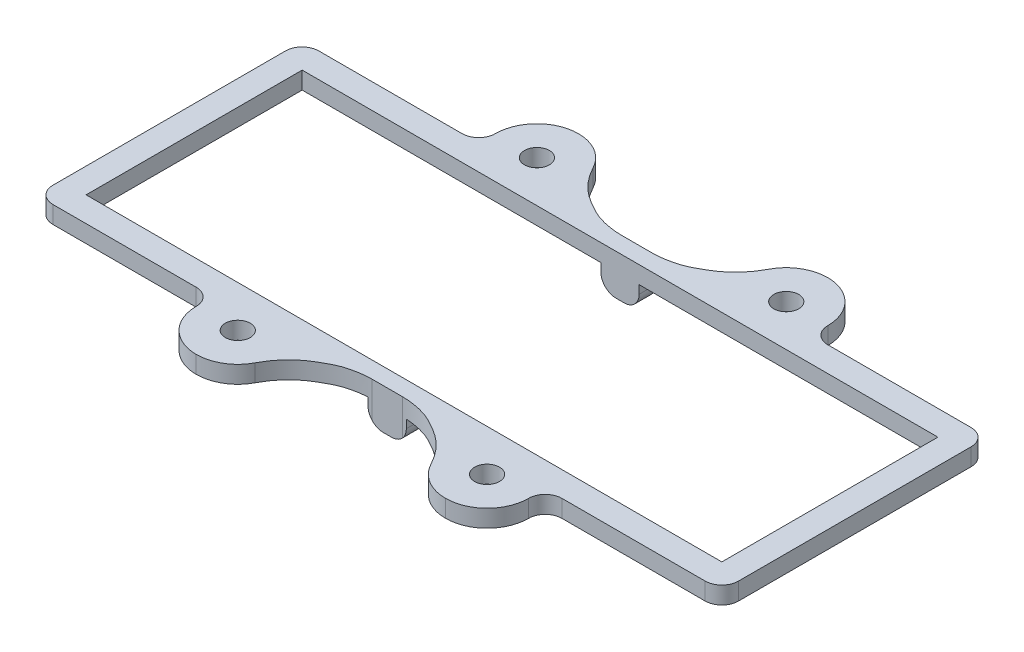
from build123d import *

# Parameters (mm, degrees)
SKETCH1_W           = 40
SKETCH1_H           = 7
SKETCH1_R           = 1.5
SKETCH1_W_2         = 82.5
SKETCH1_H_2         = 32
SKETCH1_W_3         = 76.5
SKETCH1_H_3         = 26
BOSS_EXTRUDE1_DEPTH = 2.085
SKETCH2_W           = 5
SKETCH2_H           = 10
BOSS_EXTRUDE2_DEPTH = 3
FILLET1_R           = 2
FILLET2_R           = 2
CUT_EXTRUDE1_DEPTH  = 65.136818612
SKETCH4_W           = 30
SKETCH4_H           = 6.817038716
CUT_EXTRUDE2_DEPTH  = 53.089568977
FILLET3_R           = 5
FILLET4_R           = 2


with BuildPart() as part:
    # Sketch1 → Boss-Extrude1 (new body)
    # profile 1 of 3: a face of its own
    with BuildSketch(Plane(origin=(0, 0, 0), x_dir=(1, 0, 0), z_dir=(0, 1, 0))):
        with Locations((-3.342953498, -16.024946279)):
            Rectangle(SKETCH1_W, SKETCH1_H)
        with Locations(Location((-18.342953498, -14.524946279, 0), (0, 0, 270))):
            Circle(SKETCH1_R, mode=Mode.SUBTRACT)
        with Locations(Location((11.657046502, -14.524946279, 0), (0, 0, 270))):
            Circle(SKETCH1_R, mode=Mode.SUBTRACT)
    # profile 2 of 3: a face of its own
    with BuildSketch(Plane(origin=(0, 0, 0), x_dir=(1, 0, 0), z_dir=(0, 1, 0))):
        with Locations((-3.342953498, 3.475053721)):
            Rectangle(SKETCH1_W_2, SKETCH1_H_2)
        with Locations((-3.342953498, 3.475053721)):
            Rectangle(SKETCH1_W_3, SKETCH1_H_3, mode=Mode.SUBTRACT)
    # profile 3 of 3: a face of its own
    with BuildSketch(Plane(origin=(0, 0, 0), x_dir=(1, 0, 0), z_dir=(0, 1, 0))):
        with Locations((-3.342953498, 22.975053721)):
            Rectangle(SKETCH1_W, SKETCH1_H)
        with Locations(Location((-18.342953498, 21.475053721, 0), (0, 0, 270))):
            Circle(SKETCH1_R, mode=Mode.SUBTRACT)
        with Locations(Location((11.657046502, 21.475053721, 0), (0, 0, 270))):
            Circle(SKETCH1_R, mode=Mode.SUBTRACT)
    extrude(amount=BOSS_EXTRUDE1_DEPTH)

    # Sketch2 → Boss-Extrude2 (add)
    with BuildSketch(Plane.XZ):
        with Locations((-3.342953498, 14.524946279)):
            Rectangle(SKETCH2_W, SKETCH2_H)
        with Locations((-3.342953498, -21.475053721)):
            Rectangle(SKETCH2_W, SKETCH2_H)
    extrude(amount=BOSS_EXTRUDE2_DEPTH)

    # Fillet1
    fillet1_edges = [part.edges().sort_by_distance(p)[0] for p in [
        (-5.842953498, -3, 14.524946279),
        (-0.842953498, -3, 14.524946279),
        (-0.842953498, -3, -21.475053721),
        (-5.842953498, -3, -21.475053721),
    ]]
    fillet(fillet1_edges, radius=FILLET1_R)

    # Fillet2
    fillet2_edges = [part.edges().sort_by_distance(p)[0] for p in [
        (-44.592953498, 1.0425, 12.524946279),
        (-44.592953498, 1.0425, -19.475053721),
        (37.907046502, 1.0425, -19.475053721),
        (37.907046502, 1.0425, 12.524946279),
    ]]
    fillet(fillet2_edges, radius=FILLET2_R)

    # Sketch3 → Cut-Extrude1 (cut, through all)
    with BuildSketch(Plane(origin=(0, 0, -26.475053721), x_dir=(-1, 0, 0), z_dir=(0, 0, -1))):
        with BuildLine():
            Line((5.842953498, -1), (5.842953498, 0))
            Line((5.842953498, 0), (5.642953498, 0))
            Line((5.642953498, 0), (5.642953498, -1))
            ThreePointArc((5.642953498, -1), (5.115745704, -2.272792206), (3.842953498, -2.8))
            Line((3.842953498, -2.8), (2.842953498, -2.8))
            ThreePointArc((2.842953498, -2.8), (1.570161291, -2.272792206), (1.042953498, -1))
            Line((1.042953498, -1), (1.042953498, 0))
            Line((1.042953498, 0), (0.842953498, 0))
            Line((0.842953498, 0), (0.842953498, -1))
            ThreePointArc((0.842953498, -1), (1.428739935, -2.414213562), (2.842953498, -3))
            Line((2.842953498, -3), (3.842953498, -3))
            ThreePointArc((3.842953498, -3), (5.25716706, -2.414213562), (5.842953498, -1))
        make_face()
    extrude(amount=-CUT_EXTRUDE1_DEPTH, mode=Mode.SUBTRACT)

    # Sketch4 → Cut-Extrude2 (cut, through all)
    with BuildSketch(Plane(origin=(0, 2.085, 0), x_dir=(1, 0, 0), z_dir=(0, 1, 0))):
        with BuildLine():
            Line((-5.025587433, 18.475053721), (-3.342953498, 18.475053721))
            Line((-3.342953498, 18.475053721), (-1.660319563, 18.475053721))
            Line((-1.660319563, 18.475053721), (-1.5063675, 18.475053721))
            add(Edge.make_bspline(
                [(7.234880115, 23.808387054), (6.697838422, 22.80689338), (5.54618786, 21.222701251), (3.456402004, 19.887657692), (1.890908212, 19.048171258), (0.265447838, 18.611656881), (-0.841891354, 18.480685845), (-1.5063675, 18.475053721)],
                knots=[0, 0, 0, 0, 0.31493804, 0.524439854, 0.679221784, 0.802825172, 0.985869019, 0.985869019, 0.985869019, 0.985869019], degree=3))
            ThreePointArc((7.234880115, 23.808387054), (9.075057605, 25.756797914), (11.657046502, 26.475053721))
            Line((11.657046502, 26.475053721), (-18.342953498, 26.475053721))
            ThreePointArc((-18.342953498, 26.475053721), (-15.7609646, 25.756797914), (-13.92078711, 23.808387054))
            add(Edge.make_bspline(
                [(-13.92078711, 23.808387054), (-13.383745417, 22.80689338), (-12.232094855, 21.222701251), (-10.142308999, 19.887657692), (-8.576815207, 19.048171258), (-6.951354833, 18.611656881), (-5.844015641, 18.480685845), (-5.179539495, 18.475053721)],
                knots=[0, 0, 0, 0, 0.31493804, 0.524439854, 0.679221784, 0.802825172, 0.985869019, 0.985869019, 0.985869019, 0.985869019], degree=3))
            Line((-5.179539495, 18.475053721), (-5.025587433, 18.475053721))
        make_face()
        with Locations((-3.342953498, 29.883573079)):
            Rectangle(SKETCH4_W, SKETCH4_H)
        with BuildLine():
            ThreePointArc((-13.92078711, -16.858279612), (-15.7609646, -18.806690472), (-18.342953498, -19.524946279))
            Line((-18.342953498, -19.524946279), (11.657046502, -19.524946279))
            ThreePointArc((11.657046502, -19.524946279), (9.075057605, -18.806690472), (7.234880115, -16.858279612))
            add(Edge.make_bspline(
                [(7.234880115, -16.858279612), (6.697838422, -15.856785937), (5.54618786, -14.272593809), (3.456402004, -12.937550249), (1.890908212, -12.098063816), (0.265447838, -11.661549439), (-0.841891354, -11.530578403), (-1.5063675, -11.524946279)],
                knots=[0, 0, 0, 0, 0.31493804, 0.524439854, 0.679221784, 0.802825172, 0.985869019, 0.985869019, 0.985869019, 0.985869019], degree=3))
            Line((-1.5063675, -11.524946279), (-1.660319563, -11.524946279))
            Line((-1.660319563, -11.524946279), (-3.342953498, -11.524946279))
            Line((-3.342953498, -11.524946279), (-5.025587433, -11.524946279))
            Line((-5.025587433, -11.524946279), (-5.179539495, -11.524946279))
            add(Edge.make_bspline(
                [(-13.92078711, -16.858279612), (-13.383745417, -15.856785937), (-12.232094855, -14.272593809), (-10.142308999, -12.937550249), (-8.576815207, -12.098063816), (-6.951354833, -11.661549439), (-5.844015641, -11.530578403), (-5.179539495, -11.524946279)],
                knots=[0, 0, 0, 0, 0.31493804, 0.524439854, 0.679221784, 0.802825172, 0.985869019, 0.985869019, 0.985869019, 0.985869019], degree=3))
        make_face()
        with Locations((-3.342953498, -22.933465637)):
            Rectangle(SKETCH4_W, SKETCH4_H)
    extrude(amount=-CUT_EXTRUDE2_DEPTH, mode=Mode.SUBTRACT)

    # Fillet3
    fillet3_edges = [part.edges().sort_by_distance(p)[0] for p in [
        (16.657046502, 1.0425, -26.475053721),
        (-23.342953498, 1.0425, -26.475053721),
        (-23.342953498, 1.0425, 19.524946279),
        (16.657046502, 1.0425, 19.524946279),
    ]]
    fillet(fillet3_edges, radius=FILLET3_R - 0.0001)  # a hair under: the kernel refuses the full size

    # Fillet4
    fillet4_edges = [part.edges().sort_by_distance(p)[0] for p in [
        (16.657046502, 1.0425, 12.524946279),
        (-23.342953498, 1.0425, 12.524946279),
        (-23.342953498, 1.0425, -19.475053721),
        (16.657046502, 1.0425, -19.475053721),
    ]]
    fillet(fillet4_edges, radius=FILLET4_R)


solid = part.part
